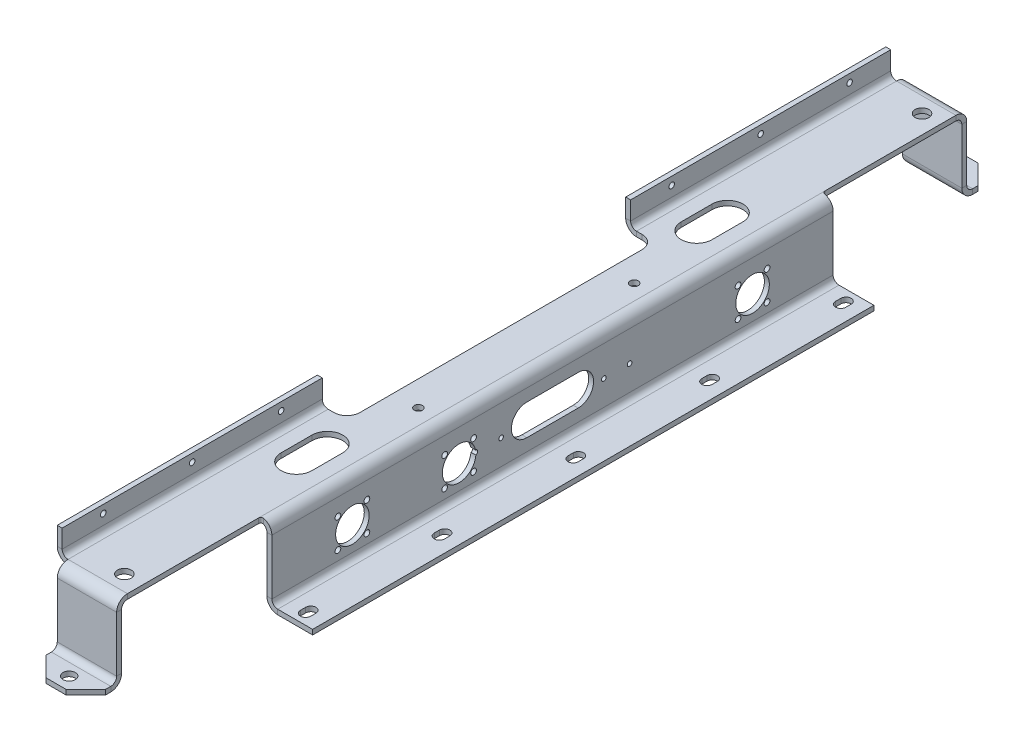
from build123d import *

# Parameters (mm, degrees)
BASE_FLANGE1_DEPTH      = 546.1
SKETCH6_W               = 18.28
SKETCH6_H               = 300
CUT_EXTRUDE1_DEPTH      = 4.78
SKETCH7_R               = 16.3195
SKETCH7_R_2             = 2.794
MOTOR_HOLES_DEPTH       = 555.841876934
GROUND_HOLES_DEPTH      = 555.217881343
SKETCH10_W              = 57.785
SKETCH10_H              = 130
TAB1_DEPTH              = 4.78
EDGE_FLANGE1_DEPTH      = 57.785
EDGE_FLANGE1_BEND_DEPTH = 57.785
EDGE_FLANGE2_DEPTH      = 57.785
EDGE_FLANGE2_BEND_DEPTH = 57.785
CHAMFER1_SIZE           = 19.05
SKETCH25_R              = 6
CUT_EXTRUDE2_DEPTH      = 4.78
EDGE_FLANGE3_DEPTH      = 253.05
EDGE_FLANGE3_BEND_DEPTH = 253.05
FILLET1_R               = 2.54
CUT_EXTRUDE5_DEPTH      = 733.179680577
CUT_EXTRUDE5_DEPTH_BACK = 733.179680577
SKETCH34_R              = 2.705
SKETCH35_R              = 2.25
CUT_EXTRUDE6_DEPTH      = 4.78
FILLET2_R               = 12.7
SKETCH36_R              = 4
CUT_EXTRUDE7_DEPTH      = 10
SKETCH37_R              = 6.746875
CUT_EXTRUDE8_DEPTH      = 10
CUT_EXTRUDE9_DEPTH      = 728.58013514
CUT_EXTRUDE10_DEPTH     = 10


# Read off the part's stored shape, not the designer's step: Base-Flange1
# Sheet-metal steps are written as plain solids
with BuildPart() as part:
    # Base-Flange1 outline → Base-Flange1 (new body)
    with BuildSketch(Plane.XY):
        with BuildLine():
            Line((-5.715, 74.78), (-63.5, 74.78))
            Line((-63.5, 74.78), (-63.5, 70))
            Line((-63.5, 70), (-5.715, 70))
            ThreePointArc((-5.715, 70), (-1.673884746, 68.326115254), (0, 64.285))
            Line((0, 64.285), (0, 10.495))
            ThreePointArc((0, 10.495), (3.073914331, 3.073914331), (10.495, 0))
            Line((10.495, 0), (44.45, 0))
            Line((44.45, 0), (44.45, 4.78))
            Line((44.45, 4.78), (10.495, 4.78))
            ThreePointArc((10.495, 4.78), (6.453884746, 6.453884746), (4.78, 10.495))
            Line((4.78, 10.495), (4.78, 64.285))
            ThreePointArc((4.78, 64.285), (1.706085669, 71.706085669), (-5.715, 74.78))
        make_face()
    extrude(amount=BASE_FLANGE1_DEPTH)

    # Sketch6 → Cut-Extrude1 (cut)
    with BuildSketch(Plane(origin=(0, 74.78, 0), x_dir=(1, 0, 0), z_dir=(0, 1, 0))):
        with Locations((-54.36, -273.05)):
            Rectangle(SKETCH6_W, SKETCH6_H)
    extrude(amount=-CUT_EXTRUDE1_DEPTH, mode=Mode.SUBTRACT)

    # Sketch7 → motor holes (cut, through all)
    with BuildSketch(Plane.ZY):
        with Locations((78.391999994, 33.73)):
            Circle(SKETCH7_R)
        with Locations((92.491002104, 47.82900211)):
            Circle(SKETCH7_R_2)
        with Locations((92.491002104, 19.63099789)):
            Circle(SKETCH7_R_2)
        with Locations((64.292997884, 19.63099789)):
            Circle(SKETCH7_R_2)
        with Locations((64.292997884, 47.82900211)):
            Circle(SKETCH7_R_2)
        with Locations((481.807002116, 47.82900211)):
            Circle(SKETCH7_R_2)
        with Locations((481.807002116, 19.63099789)):
            Circle(SKETCH7_R_2)
        with Locations((453.608997896, 19.63099789)):
            Circle(SKETCH7_R_2)
        with Locations((453.608997896, 47.82900211)):
            Circle(SKETCH7_R_2)
        with Locations((467.708000006, 33.73)):
            Circle(SKETCH7_R)
        with Locations((363.897374241, 33.73)):
            Circle(SKETCH7_R)
        with Locations((377.996376351, 47.82900211)):
            Circle(SKETCH7_R_2)
        with Locations((377.996376351, 19.63099789)):
            Circle(SKETCH7_R_2)
        with Locations((349.798372131, 19.63099789)):
            Circle(SKETCH7_R_2)
        with Locations((349.798372131, 47.82900211)):
            Circle(SKETCH7_R_2)
    extrude(amount=-MOTOR_HOLES_DEPTH, mode=Mode.SUBTRACT)

    # Sketch8 → ground holes (cut, through all)
    with BuildSketch(Plane(origin=(0, 4.78, 0), x_dir=(1, 0, 0), z_dir=(0, 1, 0))):
        with BuildLine():
            Line((32.4725, -140.335), (32.4725, -145.415))
            ThreePointArc((32.4725, -145.415), (27.4725, -150.415), (22.4725, -145.415))
            Line((22.4725, -145.415), (22.4725, -140.335))
            ThreePointArc((22.4725, -140.335), (27.4725, -135.335), (32.4725, -140.335))
        make_face()
        with BuildLine():
            Line((32.4725, -10.16), (32.4725, -15.24))
            ThreePointArc((32.4725, -15.24), (27.4725, -20.24), (22.4725, -15.24))
            Line((22.4725, -15.24), (22.4725, -10.16))
            ThreePointArc((22.4725, -10.16), (27.4725, -5.16), (32.4725, -10.16))
        make_face()
        with BuildLine():
            Line((32.4725, -270.51), (32.4725, -275.59))
            ThreePointArc((32.4725, -275.59), (27.4725, -280.59), (22.4725, -275.59))
            Line((22.4725, -275.59), (22.4725, -270.51))
            ThreePointArc((22.4725, -270.51), (27.4725, -265.51), (32.4725, -270.51))
        make_face()
        with BuildLine():
            Line((32.4725, -400.685), (32.4725, -405.765))
            ThreePointArc((32.4725, -405.765), (27.4725, -410.765), (22.4725, -405.765))
            Line((22.4725, -405.765), (22.4725, -400.685))
            ThreePointArc((22.4725, -400.685), (27.4725, -395.685), (32.4725, -400.685))
        make_face()
        with BuildLine():
            Line((32.4725, -530.86), (32.4725, -535.94))
            ThreePointArc((32.4725, -535.94), (27.4725, -540.94), (22.4725, -535.94))
            Line((22.4725, -535.94), (22.4725, -530.86))
            ThreePointArc((22.4725, -530.86), (27.4725, -525.86), (32.4725, -530.86))
        make_face()
    extrude(amount=-GROUND_HOLES_DEPTH, mode=Mode.SUBTRACT)

    # Sketch10 → Tab1 (add)
    with BuildSketch(Plane(origin=(0, 74.78, 0), x_dir=(1, 0, 0), z_dir=(0, 1, 0))):
        with Locations((-34.6075, 65)):
            Rectangle(SKETCH10_W, SKETCH10_H)
        with Locations((-34.6075, -611.1)):
            Rectangle(SKETCH10_W, SKETCH10_H)
    extrude(amount=-TAB1_DEPTH)

    # Edge-Flange1 section (across the edge) → Edge-Flange1 (add)
    with BuildSketch(Plane(origin=(-63.5, 70, -135.715), x_dir=(0, 0, 1), z_dir=(1, 0, 0))):
        with BuildLine():
            Line((-4.78, 5.715), (-4.78, 59.505))
            Line((-4.78, 59.505), (0, 59.505))
            Line((0, 59.505), (0, 5.715))
            ThreePointArc((0, 5.715), (1.673884746, 1.673884746), (5.715, 0))
            Line((5.715, 0), (5.715, -4.78))
            ThreePointArc((5.715, -4.78), (-1.706085669, -1.706085669), (-4.78, 5.715))
        make_face()
    extrude(amount=EDGE_FLANGE1_DEPTH)

    # Edge-Flange1 section 2 (across the edge) → Edge-Flange1 bend (add)
    with BuildSketch(Plane(origin=(-5.715, 70, 681.815), x_dir=(0, 0, -1), z_dir=(-1, 0, 0))):
        with BuildLine():
            Line((-4.78, 5.715), (-4.78, 59.505))
            Line((-4.78, 59.505), (0, 59.505))
            Line((0, 59.505), (0, 5.715))
            ThreePointArc((0, 5.715), (1.673884746, 1.673884746), (5.715, 0))
            Line((5.715, 0), (5.715, -4.78))
            ThreePointArc((5.715, -4.78), (-1.706085669, -1.706085669), (-4.78, 5.715))
        make_face()
    extrude(amount=EDGE_FLANGE1_BEND_DEPTH)

    # Edge-Flange2 section (across the edge) → Edge-Flange2 (add)
    with BuildSketch(Plane(origin=(-5.715, 4.78, -140.495), x_dir=(0, 1, 0), z_dir=(-1, 0, 0))):
        with BuildLine():
            Line((-4.78, 5.715), (-4.78, 30))
            Line((-4.78, 30), (0, 30))
            Line((0, 30), (0, 5.715))
            ThreePointArc((0, 5.715), (1.673884746, 1.673884746), (5.715, 0))
            Line((5.715, 0), (5.715, -4.78))
            ThreePointArc((5.715, -4.78), (-1.706085669, -1.706085669), (-4.78, 5.715))
        make_face()
    extrude(amount=EDGE_FLANGE2_DEPTH)

    # Edge-Flange2 section 2 (across the edge) → Edge-Flange2 bend (add)
    with BuildSketch(Plane(origin=(-63.5, 4.78, 686.595), x_dir=(0, 1, 0), z_dir=(1, 0, 0))):
        with BuildLine():
            Line((-4.78, 5.715), (-4.78, 30))
            Line((-4.78, 30), (0, 30))
            Line((0, 30), (0, 5.715))
            ThreePointArc((0, 5.715), (1.673884746, 1.673884746), (5.715, 0))
            Line((5.715, 0), (5.715, -4.78))
            ThreePointArc((5.715, -4.78), (-1.706085669, -1.706085669), (-4.78, 5.715))
        make_face()
    extrude(amount=EDGE_FLANGE2_BEND_DEPTH)

    # Chamfer1
    chamfer1_edges = [part.edges().sort_by_distance(p)[0] for p in [
        (-5.715, 2.39, -170.495),
        (-63.5, 2.39, -170.495),
        (-63.5, 2.39, 716.595),
        (-5.715, 2.39, 716.595),
    ]]
    chamfer(chamfer1_edges, length=CHAMFER1_SIZE)

    # Sketch25 → Cut-Extrude2 (cut)
    with BuildSketch(Plane(origin=(0, 4.78, 0), x_dir=(1, 0, 0), z_dir=(0, 1, 0))):
        with Locations(Location((-34.6075, 157.795, 0), (0, 0, 180))):
            Circle(SKETCH25_R)
        with Locations(Location((-34.6075, -703.895, 0), (0, 0, 180))):
            Circle(SKETCH25_R)
    extrude(amount=-CUT_EXTRUDE2_DEPTH, mode=Mode.SUBTRACT)

    # Edge-Flange3 section (across the edge) → Edge-Flange3 (add)
    with BuildSketch(Plane(origin=(-69.215, 74.78, 423.05), x_dir=(1, 0, 0), z_dir=(0, 0, 1))):
        with BuildLine():
            Line((-4.78, 5.715), (-4.78, 23.5))
            Line((-4.78, 23.5), (0, 23.5))
            Line((0, 23.5), (0, 5.715))
            ThreePointArc((0, 5.715), (1.673884746, 1.673884746), (5.715, 0))
            Line((5.715, 0), (5.715, -4.78))
            ThreePointArc((5.715, -4.78), (-1.706085669, -1.706085669), (-4.78, 5.715))
        make_face()
    extrude(amount=EDGE_FLANGE3_DEPTH)

    # Edge-Flange3 section 2 (across the edge) → Edge-Flange3 bend (add)
    with BuildSketch(Plane(origin=(-69.215, 74.78, -130), x_dir=(1, 0, 0), z_dir=(0, 0, 1))):
        with BuildLine():
            Line((-4.78, 5.715), (-4.78, 23.5))
            Line((-4.78, 23.5), (0, 23.5))
            Line((0, 23.5), (0, 5.715))
            ThreePointArc((0, 5.715), (1.673884746, 1.673884746), (5.715, 0))
            Line((5.715, 0), (5.715, -4.78))
            ThreePointArc((5.715, -4.78), (-1.706085669, -1.706085669), (-4.78, 5.715))
        make_face()
    extrude(amount=EDGE_FLANGE3_BEND_DEPTH)

    # Fillet1
    # the kernel refuses this fillet: 2.54 mm, written as the material it adds along each edge
    with BuildSketch(Plane(origin=(-5.715, 81.13, 0), x_dir=(0, 0, -1), z_dir=(0, -1, 0))) as fillet1_piece_1_section:
        with BuildLine():
            CenterArc((FILLET1_R, FILLET1_R), FILLET1_R, 180, 90)
            Line((0, FILLET1_R), (0, 0))
            Line((0, 0), (FILLET1_R, 0))
        make_face()
    fillet1_piece_1 = extrude(amount=17.48, mode=Mode.PRIVATE)
    fillet1_piece_1 = fillet1_piece_1 - Plane(origin=(-5.715000002, 64.284999998, -0.569270741), x_dir=(2.8742650324071376e-10, 1.0, 0), z_dir=(0, 0, -1)) * Cylinder(5.715000002, 46, mode=Mode.PRIVATE)
    fillet1_piece_1 = fillet1_piece_1 & Plane(origin=(-5.714999998, 64.285000002, -0.569270741), x_dir=(1.0, -1.4547744727146124e-10, 0), z_dir=(0, 0, -1)) * Cylinder(10.494999998, 46, mode=Mode.PRIVATE)
    add(fillet1_piece_1)
    with BuildSketch(Plane(origin=(-5.715, 81.13, 546.1), x_dir=(0, 0, 1), z_dir=(0, -1, 0))) as fillet1_piece_2_section:
        with BuildLine():
            CenterArc((FILLET1_R, -FILLET1_R), FILLET1_R, 90, 90)
            Line((0, -FILLET1_R), (0, 0))
            Line((0, 0), (FILLET1_R, 0))
        make_face()
    fillet1_piece_2 = extrude(amount=17.48, mode=Mode.PRIVATE)
    fillet1_piece_2 = fillet1_piece_2 - Plane(origin=(-5.715000002, 64.284999998, 546.669270744), x_dir=(2.8742650324071376e-10, 1.0, 0), z_dir=(0, 0, -1)) * Cylinder(5.715000002, 46, mode=Mode.PRIVATE)
    fillet1_piece_2 = fillet1_piece_2 & Plane(origin=(-5.714999998, 64.285000002, 546.669270744), x_dir=(1.0, -1.4547744727146124e-10, 0), z_dir=(0, 0, -1)) * Cylinder(10.494999998, 46, mode=Mode.PRIVATE)
    add(fillet1_piece_2)

    # Sketch34 → Cut-Extrude5 (cut, two sides: drawn at the far end of the back side and taken through both)
    with BuildSketch(Plane(origin=(-69.215, 0, 0), x_dir=(0, 0, -1), z_dir=(1, 0, 0)).offset(-CUT_EXTRUDE5_DEPTH_BACK)):
        with Locations(Location((90, 90.495, 0), (0, 0, 90))):
            Circle(SKETCH34_R)
        with Locations(Location((-83.05, 90.495, 0), (0, 0, 90))):
            Circle(SKETCH34_R)
        with Locations(Location((3.475, 90.495, 0), (0, 0, 90))):
            Circle(SKETCH34_R)
        with Locations(Location((-549.575, 90.495, 0), (0, 0, 90))):
            Circle(SKETCH34_R)
        with Locations(Location((-463.05, 90.495, 0), (0, 0, 90))):
            Circle(SKETCH34_R)
        with Locations(Location((-636.1, 90.495, 0), (0, 0, 90))):
            Circle(SKETCH34_R)
    extrude(amount=CUT_EXTRUDE5_DEPTH + CUT_EXTRUDE5_DEPTH_BACK, mode=Mode.SUBTRACT)

    # Sketch35 → Cut-Extrude6 (cut)
    with BuildSketch(Plane(origin=(4.78, 0, 0), x_dir=(0, 0, -1), z_dir=(1, 0, 0))):
        with Locations((-348.05, 34.78)):
            Circle(SKETCH35_R)
        with Locations((-198.05, 34.78)):
            Circle(SKETCH35_R)
        with Locations((-323.05, 34.78)):
            Circle(SKETCH35_R)
        with Locations((-223.05, 34.78)):
            Circle(SKETCH35_R)
    extrude(amount=-CUT_EXTRUDE6_DEPTH, mode=Mode.SUBTRACT)

    # Fillet2
    fillet2_edges = [part.edges().sort_by_distance(p)[0] for p in [
        (-45.22, 72.39, 423.05),
        (-45.22, 72.39, 123.05),
    ]]
    fillet(fillet2_edges, radius=FILLET2_R)

    # Sketch36 → Cut-Extrude7 (cut)
    with BuildSketch(Plane(origin=(0, 74.78, 0), x_dir=(1, 0, 0), z_dir=(0, 1, 0))):
        with Locations(Location((-20.715, -378.05, 0), (0, 0, 270))):
            Circle(SKETCH36_R)
        with Locations(Location((-20.715, -168.05, 0), (0, 0, 90))):
            Circle(SKETCH36_R)
    extrude(amount=-CUT_EXTRUDE7_DEPTH, mode=Mode.SUBTRACT)

    # Sketch37 → Cut-Extrude8 (cut)
    with BuildSketch(Plane(origin=(0, 74.78, 0), x_dir=(1, 0, 0), z_dir=(0, 1, 0))):
        with Locations(Location((-23.715, -661.1, 0), (0, 0, 270))):
            Circle(SKETCH37_R)
        with Locations(Location((-23.715, 115, 0), (0, 0, 90))):
            Circle(SKETCH37_R)
    extrude(amount=-CUT_EXTRUDE8_DEPTH, mode=Mode.SUBTRACT)

    # Sketch38 → Cut-Extrude9 (cut, through all)
    with BuildSketch(Plane(origin=(4.78, 0, 0), x_dir=(0, 0, -1), z_dir=(1, 0, 0))):
        with BuildLine():
            Line((-248.05, 22.39), (-298.05, 22.39))
            ThreePointArc((-298.05, 22.39), (-313.05, 37.39), (-298.05, 52.39))
            Line((-298.05, 52.39), (-248.05, 52.39))
            ThreePointArc((-248.05, 52.39), (-233.05, 37.39), (-248.05, 22.39))
        make_face()
    extrude(amount=-CUT_EXTRUDE9_DEPTH, mode=Mode.SUBTRACT)

    # Sketch39 → Cut-Extrude10 (cut)
    with BuildSketch(Plane(origin=(0, 74.78, 0), x_dir=(1, 0, 0), z_dir=(0, 1, 0))):
        with BuildLine():
            Line((-19.6075, -63.391999994), (-19.6075, -93.391999994))
            ThreePointArc((-19.6075, -93.391999994), (-34.6075, -108.391999994), (-49.6075, -93.391999994))
            Line((-49.6075, -93.391999994), (-49.6075, -63.391999994))
            ThreePointArc((-49.6075, -63.391999994), (-34.6075, -48.391999994), (-19.6075, -63.391999994))
        make_face()
        with BuildLine():
            Line((-19.6075, -482.708000006), (-19.6075, -452.708000006))
            ThreePointArc((-19.6075, -452.708000006), (-34.6075, -437.708000006), (-49.6075, -452.708000006))
            Line((-49.6075, -452.708000006), (-49.6075, -482.708000006))
            ThreePointArc((-49.6075, -482.708000006), (-34.6075, -497.708000006), (-19.6075, -482.708000006))
        make_face()
    extrude(amount=-CUT_EXTRUDE10_DEPTH, mode=Mode.SUBTRACT)


solid = part.part
